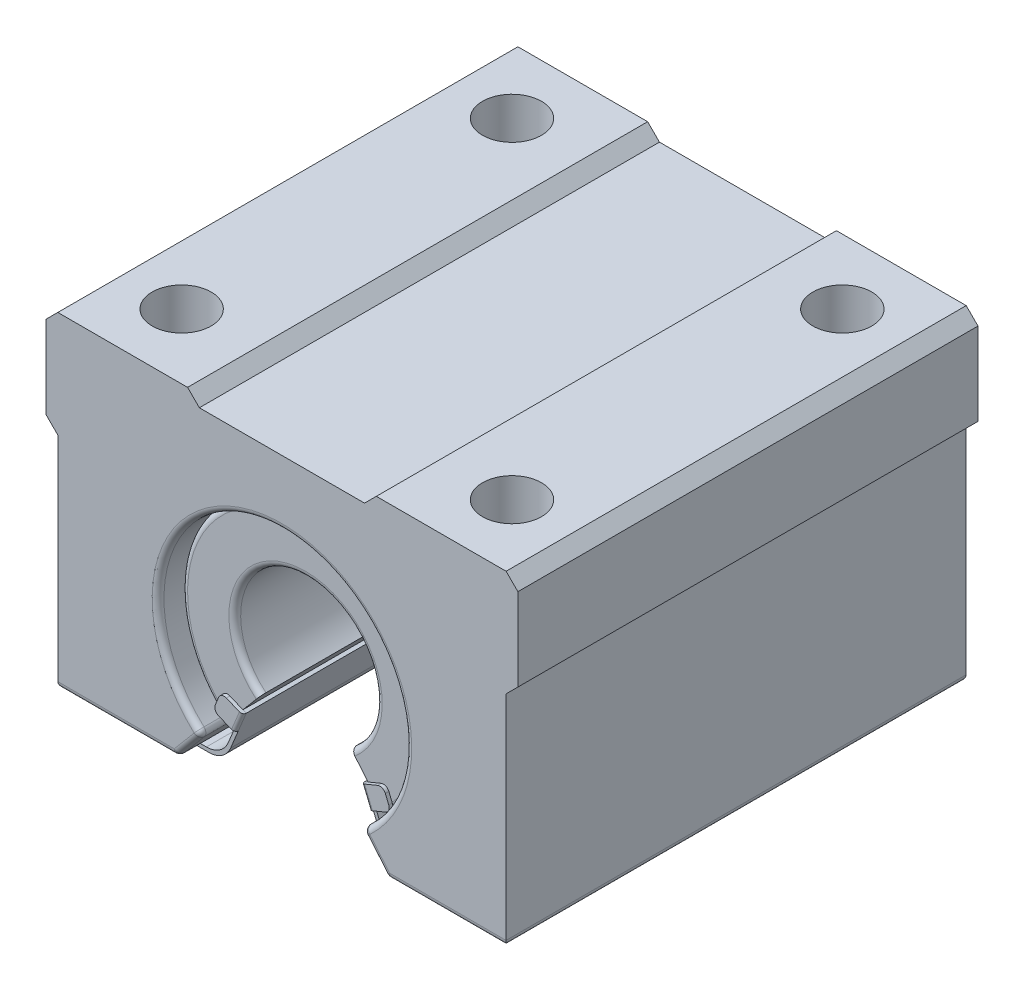
from build123d import *

# Parameters (mm, degrees)
SKETCH2_W                  = 40
SKETCH2_H                  = 27.6
BOSS_EXTRUDE1_DEPTH        = 39
SKETCH3_W                  = 1
SKETCH3_H                  = 19.6
SKETCH3_W_2                = 16
SKETCH3_H_2                = 1
CUT_EXTRUDE1_DEPTH         = 39
CUT_EXTRUDE2_DEPTH         = 39
FILLET1_R                  = 0.5
CHAMFER1_SIZE              = 1
SKETCH7_R                  = 2.5
CUT_EXTRUDE4_DEPTH         = 10
BOSS_EXTRUDE2_DEPTH        = 17.5
BOSS_EXTRUDE2_DEPTH_BACK   = 17.5
FILLET2_R                  = 0.5
BOSS_EXTRUDE4_DEPTH        = 17.5
BOSS_EXTRUDE4_DEPTH_BACK   = 17.5
BOSS_EXTRUDE4_2_DEPTH      = 17.5
BOSS_EXTRUDE4_2_DEPTH_BACK = 17.5
FILLET5_R                  = 0.5
FILLET4_R                  = 0.5
BOSS_EXTRUDE9_DEPTH        = 0.3
BOSS_EXTRUDE9_2_DEPTH      = 0.3
FILLET6_R                  = 0.5
FILLET7_R                  = 0.5
FILLET8_R                  = 0.3
FILLET9_R                  = 0.3
BOSS_EXTRUDE13_DEPTH       = 0.3
BOSS_EXTRUDE13_2_DEPTH     = 0.3
FILLET10_R                 = 0.5
FILLET11_R                 = 0.5
FILLET12_R                 = 0.3
FILLET13_R                 = 0.3


with BuildPart() as part:
    # Sketch2 → Boss-Extrude1 (new body)
    with BuildSketch(Plane.XY):
        with Locations((0, 3.2)):
            Rectangle(SKETCH2_W, SKETCH2_H)
    extrude(amount=BOSS_EXTRUDE1_DEPTH)

    # Sketch3 → Cut-Extrude1 (cut)
    with BuildSketch(Plane.XY):
        with Locations((-19.5, -0.8)):
            Rectangle(SKETCH3_W, SKETCH3_H)
        with Locations((19.5, -0.8)):
            Rectangle(SKETCH3_W, SKETCH3_H)
        with Locations((0, 16.5)):
            Rectangle(SKETCH3_W_2, SKETCH3_H_2)
    extrude(amount=CUT_EXTRUDE1_DEPTH, mode=Mode.SUBTRACT)

    # Sketch4 → Cut-Extrude2 (cut)
    with BuildSketch(Plane.XY):
        with BuildLine():
            Line((-8.89445609, -10.6), (-6.749269902, -8.043466653))
            ThreePointArc((-6.749269902, -8.043466653), (0, 10.5), (6.749269902, -8.043466653))
            Line((6.749269902, -8.043466653), (8.89445609, -10.6))
            Line((8.89445609, -10.6), (-8.89445609, -10.6))
        make_face()
    extrude(amount=CUT_EXTRUDE2_DEPTH, mode=Mode.SUBTRACT)

    # Fillet1
    fillet1_edges = [part.edges().sort_by_distance(p)[0] for p in [
        (-13.947228045, -10.6, 0),
        (-13.947228045, -10.6, 39),
        (-19, -10.6, 19.5),
        (19, -10.6, 19.5),
        (13.947228045, -10.6, 0),
        (13.947228045, -10.6, 39),
        (0, 10.5, 0),
        (6.749269902, -8.043466653, 19.5),
        (-7.821862996, -9.321733326, 0),
        (-6.749269902, -8.043466653, 19.5),
        (-8.89445609, -10.6, 19.5),
        (7.821862996, -9.321733326, 0),
        (8.89445609, -10.6, 19.5),
        (0, 10.5, 39),
        (-7.821862996, -9.321733326, 39),
        (7.821862996, -9.321733326, 39),
    ]]
    fillet(fillet1_edges, radius=FILLET1_R)

    # Chamfer1
    chamfer1_edges = [part.edges().sort_by_distance(p)[0] for p in [
        (8, 16, 19.5),
        (-8, 16, 19.5),
        (-19, 9, 19.5),
        (19, 9, 19.5),
        (-20, 17, 19.5),
        (20, 17, 19.5),
    ]]
    chamfer(chamfer1_edges, length=CHAMFER1_SIZE - 0.0001)  # a hair under: the kernel refuses the full size

    # Sketch7 → Cut-Extrude4 (cut)
    with BuildSketch(Plane(origin=(0, 17, 0), x_dir=(1, 0, 0), z_dir=(0, 1, 0))):
        with Locations(Location((-14, -5.5, 0), (0, 0, 180))):
            Circle(SKETCH7_R)
        with Locations(Location((14, -5.5, 0), (0, 0, 180))):
            Circle(SKETCH7_R)
        with Locations(Location((-14, -33.5, 0), (0, 0, 180))):
            Circle(SKETCH7_R)
        with Locations(Location((14, -33.5, 0), (0, 0, 180))):
            Circle(SKETCH7_R)
    extrude(amount=-CUT_EXTRUDE4_DEPTH, mode=Mode.SUBTRACT)


with BuildPart() as body_2:
    # Sketch8 → Boss-Extrude2 (new, two sides: drawn at the far end of the back side and taken through both)
    with BuildSketch(Plane.XY.offset(19.5).offset(-BOSS_EXTRUDE2_DEPTH_BACK)):
        with BuildLine():
            Line((-6.749269902, -8.043466653), (-3.856725658, -4.596266659))
            ThreePointArc((-3.856725658, -4.596266659), (0, 6), (3.856725658, -4.596266659))
            Line((3.856725658, -4.596266659), (6.749269902, -8.043466653))
            ThreePointArc((6.749269902, -8.043466653), (0, 10.5), (-6.749269902, -8.043466653))
        make_face()
    extrude(amount=BOSS_EXTRUDE2_DEPTH + BOSS_EXTRUDE2_DEPTH_BACK)

    # Fillet2
    fillet2_edges = [body_2.edges().sort_by_distance(p)[0] for p in [
        (0, 10.5, 37),
        (0, 6, 2),
        (0, 6, 37),
        (0, 10.5, 2),
    ]]
    fillet(fillet2_edges, radius=FILLET2_R)


with BuildPart() as body_3:
    # Sketch9 → Boss-Extrude4 (new, two sides: drawn at the far end of the back side and taken through both)
    with BuildSketch(Plane.XY.offset(19.5).offset(-BOSS_EXTRUDE4_DEPTH_BACK)):
        with BuildLine():
            Line((-17, -10.6), (-8.403334373, -10.6))
            ThreePointArc((-8.403334373, -10.6), (-7.290114731, -10.261548082), (-6.553666412, -9.360742028))
            Line((-6.553666412, -9.360742028), (-5.30299778, -6.319866656))
            Line((-5.30299778, -6.319866656), (-5.025547586, -6.43397796))
            Line((-5.025547586, -6.43397796), (-6.352669585, -9.660742028))
            ThreePointArc((-6.352669585, -9.660742028), (-7.089117904, -10.561548082), (-8.202337546, -10.9))
            Line((-8.202337546, -10.9), (-17, -10.9))
            Line((-17, -10.9), (-17, -10.6))
        make_face()
    extrude(amount=BOSS_EXTRUDE4_DEPTH + BOSS_EXTRUDE4_DEPTH_BACK)

    # Fillet4
    fillet4_edges = [body_3.edges().sort_by_distance(p)[0] for p in [
        (-17, -10.75, 37),
        (-17, -10.75, 2),
    ]]
    fillet(fillet4_edges, radius=FILLET4_R)


with BuildPart() as body_4:
    # Sketch9 → Boss-Extrude4 2 (new, two sides: drawn at the far end of the back side and taken through both)
    with BuildSketch(Plane.XY.offset(19.5).offset(-BOSS_EXTRUDE4_2_DEPTH_BACK)):
        with BuildLine():
            Line((17, -10.6), (17, -10.9))
            Line((17, -10.9), (8.202337546, -10.9))
            ThreePointArc((8.202337546, -10.9), (7.089117904, -10.561548082), (6.352669585, -9.660742028))
            Line((6.352669585, -9.660742028), (5.025547586, -6.43397796))
            Line((5.025547586, -6.43397796), (5.30299778, -6.319866656))
            Line((5.30299778, -6.319866656), (6.553666412, -9.360742028))
            ThreePointArc((6.553666412, -9.360742028), (7.290114731, -10.261548082), (8.403334373, -10.6))
            Line((8.403334373, -10.6), (17, -10.6))
        make_face()
    extrude(amount=BOSS_EXTRUDE4_2_DEPTH + BOSS_EXTRUDE4_2_DEPTH_BACK)

    # Fillet5
    fillet5_edges = [body_4.edges().sort_by_distance(p)[0] for p in [
        (17, -10.75, 2),
        (17, -10.75, 37),
    ]]
    fillet(fillet5_edges, radius=FILLET5_R)


with BuildPart() as body_5:
    # Sketch11 → Boss-Extrude9 (new body)
    with BuildSketch(Plane.XY.offset(2)):
        Polygon((-5.025547586, -6.43397796), (-6.875215547, -5.673235932), (-7.54514678, -7.30210655), (-5.695478819, -8.062848578), align=None)
    extrude(amount=-BOSS_EXTRUDE9_DEPTH)

    # Fillet7
    fillet7_edges = [body_5.edges().sort_by_distance(p)[0] for p in [
        (-7.54514678, -7.30210655, 1.85),
        (-6.875215547, -5.673235932, 1.85),
    ]]
    fillet(fillet7_edges, radius=FILLET7_R)

    # Fillet9
    fillet9_edges = [body_5.edges().sort_by_distance(p)[0] for p in [
        (-5.360513202, -7.248413269, 1.7),
    ]]
    fillet(fillet9_edges, radius=FILLET9_R - 0.0001)  # a hair under: the kernel refuses the full size


with BuildPart() as body_6:
    # Sketch11 → Boss-Extrude9 2 (new body)
    with BuildSketch(Plane.XY.offset(2)):
        Polygon((5.025547586, -6.43397796), (6.875215547, -5.673235932), (7.54514678, -7.30210655), (5.695478819, -8.062848578), align=None)
    extrude(amount=-BOSS_EXTRUDE9_2_DEPTH)

    # Fillet6
    fillet6_edges = [body_6.edges().sort_by_distance(p)[0] for p in [
        (6.875215547, -5.673235932, 1.85),
        (7.54514678, -7.30210655, 1.85),
    ]]
    fillet(fillet6_edges, radius=FILLET6_R)

    # Fillet8
    fillet8_edges = [body_6.edges().sort_by_distance(p)[0] for p in [
        (5.360513202, -7.248413269, 1.7),
    ]]
    fillet(fillet8_edges, radius=FILLET8_R - 0.0001)  # a hair under: the kernel refuses the full size


with BuildPart() as body_7:
    # Sketch13 → Boss-Extrude13 (new body)
    with BuildSketch(Plane.XY.offset(37)):
        Polygon((-5.025547586, -6.43397796), (-5.695478819, -8.062848578), (-7.54514678, -7.30210655), (-6.875215547, -5.673235932), align=None)
    extrude(amount=BOSS_EXTRUDE13_DEPTH)

    # Fillet11
    fillet11_edges = [body_7.edges().sort_by_distance(p)[0] for p in [
        (-7.54514678, -7.30210655, 37.15),
        (-6.875215547, -5.673235932, 37.15),
    ]]
    fillet(fillet11_edges, radius=FILLET11_R)

    # Fillet12
    fillet12_edges = [body_7.edges().sort_by_distance(p)[0] for p in [
        (-5.360513202, -7.248413269, 37.3),
    ]]
    fillet(fillet12_edges, radius=FILLET12_R - 0.0001)  # a hair under: the kernel refuses the full size


with BuildPart() as body_8:
    # Sketch13 → Boss-Extrude13 2 (new body)
    with BuildSketch(Plane.XY.offset(37)):
        Polygon((5.025547586, -6.43397796), (5.695478819, -8.062848578), (7.54514678, -7.30210655), (6.875215547, -5.673235932), align=None)
    extrude(amount=BOSS_EXTRUDE13_2_DEPTH)

    # Fillet10
    fillet10_edges = [body_8.edges().sort_by_distance(p)[0] for p in [
        (6.875215547, -5.673235932, 37.15),
        (7.54514678, -7.30210655, 37.15),
    ]]
    fillet(fillet10_edges, radius=FILLET10_R)

    # Fillet13
    fillet13_edges = [body_8.edges().sort_by_distance(p)[0] for p in [
        (5.360513202, -7.248413269, 37.3),
    ]]
    fillet(fillet13_edges, radius=FILLET13_R - 0.0001)  # a hair under: the kernel refuses the full size


solid = Compound([part.part, body_2.part, body_3.part, body_4.part, body_5.part, body_6.part, body_7.part, body_8.part])
